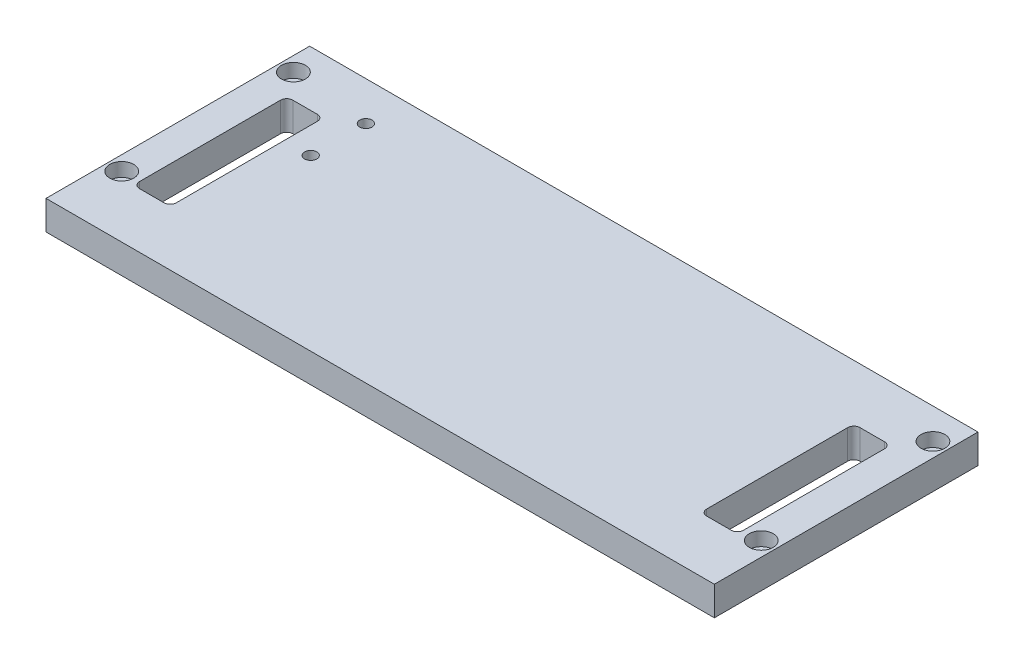
from build123d import *

# Parameters (mm, degrees)
SKETCH_1_W          = 218
SKETCH_1_H          = 86
EXTRUDE_1_DEPTH     = 9.5
SKETCH_2_W          = 12
SKETCH_2_H          = 50
CUT_EXTRUDE_1_DEPTH = 118.559559373
FILLET_1_R          = 2
FILLET_2_R          = 2
SKETCH_4_R          = 1.95
CUT_EXTRUDE_3_DEPTH = 118.559559373
SKETCH_5_R          = 3.9
CUT_EXTRUDE_4_DEPTH = 4.5
SKETCH_8_R          = 2
CUT_EXTRUDE_6_DEPTH = 118.559559373
SKETCH_9_R          = 4
CUT_EXTRUDE_7_DEPTH = 4.5


with BuildPart() as part:
    # 草图1 → 凸台-拉伸1 (new body)
    with BuildSketch(Plane(origin=(0, 0, 0), x_dir=(1, 0, 0), z_dir=(0, 1, 0))):
        Rectangle(SKETCH_1_W, SKETCH_1_H)
    extrude(amount=EXTRUDE_1_DEPTH)

    # 草图2 → 切除-拉伸1 (cut, through all)
    with BuildSketch(Plane(origin=(0, 9.5, 0), x_dir=(1, 0, 0), z_dir=(0, 1, 0))):
        with Locations((-92.5, 0)):
            Rectangle(SKETCH_2_W, SKETCH_2_H)
    cut_extrude_1 = extrude(amount=-CUT_EXTRUDE_1_DEPTH, mode=Mode.SUBTRACT)

    # 圆角1
    fillet_1_edges = [part.edges().sort_by_distance(p)[0] for p in [
        (-98.5, 4.75, -25),
        (-86.5, 4.75, -25),
        (-86.5, 4.75, 25),
        (-98.5, 4.75, 25),
    ]]
    fillet(fillet_1_edges, radius=FILLET_1_R)

    # 镜向3: 切除-拉伸1 across plane
    add(cut_extrude_1.mirror(Plane(origin=(0, 0, 0), x_dir=(0, 0, 1), z_dir=(1, 0, 0))), mode=Mode.SUBTRACT)

    # 圆角2
    fillet_2_edges = [part.edges().sort_by_distance(p)[0] for p in [
        (86.5, 4.75, -25),
        (98.5, 4.75, -25),
        (98.5, 4.75, 25),
        (86.5, 4.75, 25),
    ]]
    fillet(fillet_2_edges, radius=FILLET_2_R)

    # 草图4 → 切除-拉伸3 (cut, through all)
    with BuildSketch(Plane.XZ):
        with Locations((104.3, 23)):
            Circle(SKETCH_4_R)
        with Locations((104.3, -33)):
            Circle(SKETCH_4_R)
    cut_extrude_3 = extrude(amount=-CUT_EXTRUDE_3_DEPTH, mode=Mode.SUBTRACT)

    # 镜向4: 切除-拉伸3 across plane
    add(cut_extrude_3.mirror(Plane(origin=(0, 0, 0), x_dir=(0, 0, 1), z_dir=(1, 0, 0))), mode=Mode.SUBTRACT)

    # 草图5 → 切除-拉伸4 (cut)
    with BuildSketch(Plane(origin=(0, 9.5, 0), x_dir=(1, 0, 0), z_dir=(0, 1, 0))):
        with Locations((104.3, -23)):
            Circle(SKETCH_5_R)
        with Locations((104.3, 33)):
            Circle(SKETCH_5_R)
        with Locations((-104.3, -23)):
            Circle(SKETCH_5_R)
        with Locations((-104.3, 33)):
            Circle(SKETCH_5_R)
    extrude(amount=-CUT_EXTRUDE_4_DEPTH, mode=Mode.SUBTRACT)

    # 草图8 → 切除-拉伸6 (cut, through all)
    with BuildSketch(Plane.XZ):
        with Locations((-77.956961481, -12.3)):
            Circle(SKETCH_8_R)
        with Locations((-77.956961481, -30.3)):
            Circle(SKETCH_8_R)
    extrude(amount=-CUT_EXTRUDE_6_DEPTH, mode=Mode.SUBTRACT)

    # 草图9 → 切除-拉伸7 (cut)
    with BuildSketch(Plane.XZ):
        with Locations((-77.956961481, -12.3)):
            Circle(SKETCH_9_R)
        with Locations((-77.956961481, -30.3)):
            Circle(SKETCH_9_R)
    extrude(amount=-CUT_EXTRUDE_7_DEPTH, mode=Mode.SUBTRACT)


solid = part.part
